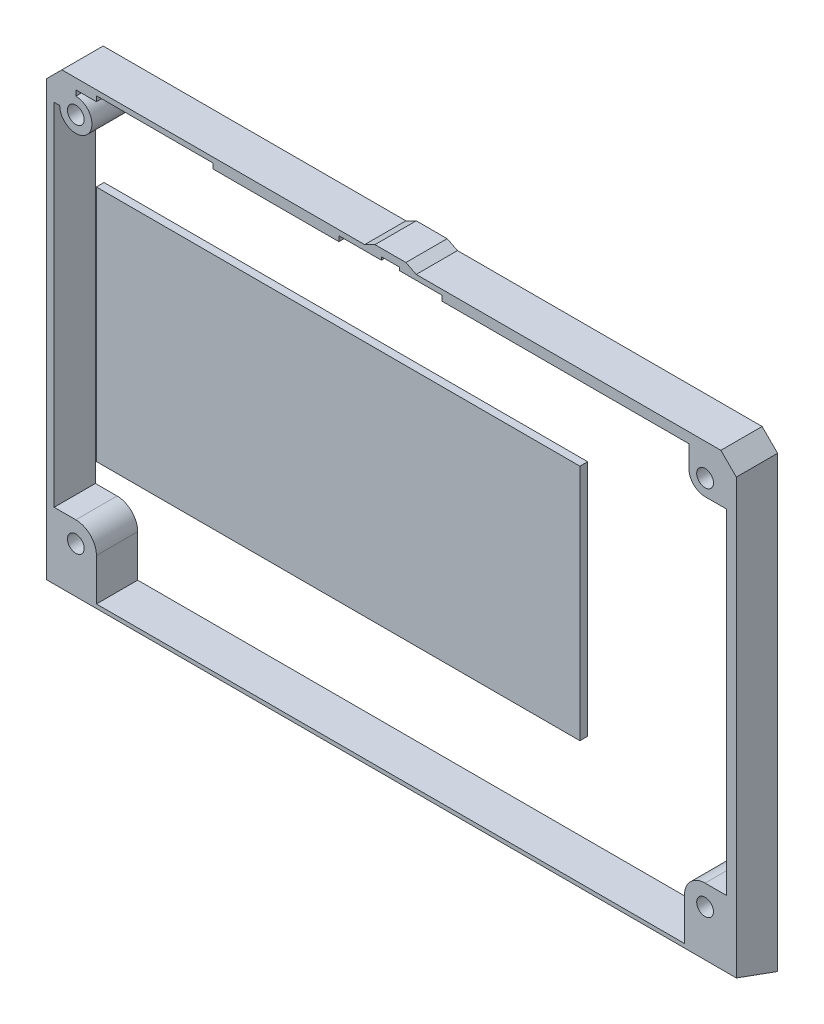
from build123d import *

# Parameters (mm, degrees)
SKETCH1_R           = 1.62500056
BOSS_EXTRUDE1_DEPTH = 8
CUT_EXTRUDE1_DEPTH  = 143.382327669
SKETCH3_W           = 93.760231923
SKETCH3_H           = 46.103458809
BOSS_EXTRUDE2_DEPTH = 1.5


with BuildPart() as part:
    # Sketch1 → Boss-Extrude1 (new body)
    with BuildSketch(Plane.XY):
        Polygon((-66.7, -48.134474014), (67.060231922, -48.134474014), (67.060231922, 39.2), (64.060231922, 42.2), (5, 42.2), (3, 43.2), (-3, 43.2), (-5, 42.2), (-63.7, 42.2), (-66.7, 39.2), align=None)
        with BuildLine():
            Line((-56.99999784, -44.134474014), (-56.99999784, -35.99999786))
            ThreePointArc((-56.99999784, -35.99999786), (-58.171570715, -33.171570735), (-60.99999784, -31.99999786))
            Line((-60.99999784, -31.99999786), (-65.2, -31.99999786))
            Line((-65.2, -31.99999786), (-65.2, 32.00000038))
            Line((-65.2, 32.00000038), (-65.2, 36.00000038))
            Line((-65.2, 36.00000038), (-64.1249984, 36.00000038))
            ThreePointArc((-64.1249984, 36.00000038), (-58.790288753, 33.790291293), (-60.99999784, 39.12500094))
            Line((-60.99999784, 39.12500094), (-60.99999784, 40.2))
            Line((-60.99999784, 40.2), (-56.99999784, 40.2))
            Line((-56.99999784, 40.2), (-56.99999784, 41.2))
            Line((-56.99999784, 41.2), (-34.380966811, 41.2))
            Line((-34.380966811, 41.2), (-34.380966811, 40.2))
            Line((-34.380966811, 40.2), (-10, 40.2))
            Line((-10, 40.2), (-10, 41.2))
            Line((-10, 41.2), (-1.75, 41.2))
            Line((-1.75, 41.2), (-1.75, 41.799998981))
            Line((-1.75, 41.799998981), (1.75, 41.799998981))
            Line((1.75, 41.799998981), (1.75, 41.2))
            Line((1.75, 41.2), (10, 41.2))
            Line((10, 41.2), (10, 40.2))
            Line((10, 40.2), (57.000002, 40.2))
            Line((57.000002, 40.2), (57.87500144, 40.2))
            Line((57.87500144, 40.2), (57.87500144, 36.00000038))
            ThreePointArc((57.87500144, 36.00000038), (58.790292913, 33.790291293), (61.000002, 32.87499982))
            Line((61.000002, 32.87499982), (65.20000162, 32.87499982))
            Line((65.20000162, 32.87499982), (65.20000162, -31.99999786))
            Line((65.20000162, -31.99999786), (61.000002, -31.99999786))
            ThreePointArc((61.000002, -31.99999786), (58.171574875, -33.171570735), (57.000002, -35.99999786))
            Line((57.000002, -35.99999786), (57.000002, -44.134474014))
            Line((57.000002, -44.134474014), (-56.99999784, -44.134474014))
        make_face(mode=Mode.SUBTRACT)
        with Locations((61.000002, -35.99999786)):
            Circle(SKETCH1_R, mode=Mode.SUBTRACT)
        with Locations((-60.99999784, -35.99999786)):
            Circle(SKETCH1_R, mode=Mode.SUBTRACT)
        with Locations((61.000002, 36.00000038)):
            Circle(SKETCH1_R, mode=Mode.SUBTRACT)
        with Locations((-60.99999784, 36.00000038)):
            Circle(SKETCH1_R, mode=Mode.SUBTRACT)
    extrude(amount=BOSS_EXTRUDE1_DEPTH)

    # Sketch2 → Cut-Extrude1 (cut, through all)
    with BuildSketch(Plane.ZY.offset(66.7)):
        Polygon((0.489360219, -47.637108129), (26.189203179, -38.283130266), (27.850109995, -42.846434237), (-0.168950275, -53.044538167), (-1.829857091, -48.481234197), align=None)
    extrude(amount=-CUT_EXTRUDE1_DEPTH, mode=Mode.SUBTRACT)


with BuildPart() as body_2:
    # Sketch3 → Boss-Extrude2 (new body)
    with BuildSketch(Plane(origin=(7.36e-07, 0, 16.827500956), x_dir=(0.999999999999999, 0, -4.371140912995992e-08), z_dir=(4.371140912995992e-08, 0, 0.9999999999999991))):
        with Locations((0.180115611, 13.148270596)):
            Rectangle(SKETCH3_W, SKETCH3_H)
    extrude(amount=BOSS_EXTRUDE2_DEPTH)


solid = Compound([part.part, body_2.part])
